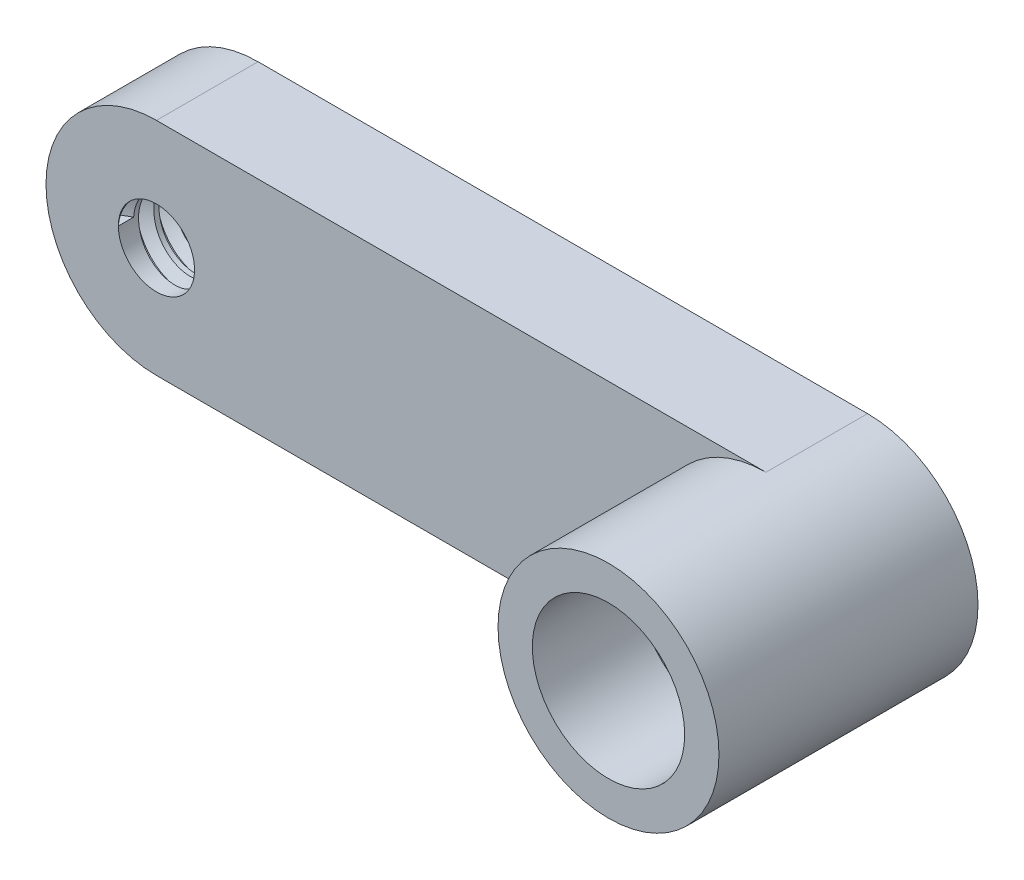
from build123d import *
from build123d.topology import SkipClean

# Parameters (mm, degrees)
SKETCH_1_R           = 1.72343644
SKETCH_1_R_2         = 1.5
EXTRUDE_1_DEPTH      = 2.1
EXTRUDE_START        = -2.1
SKETCH_12_R          = 2.175
SKETCH_12_R_2        = 1.72343644
EXTRUDE_4_DEPTH      = 2.1
EXTRUDE_START_2      = 3
EXTRUDE_6_DEPTH      = 3
SKETCH_16_R          = 1
CUT_EXTRUDE_10_DEPTH = 15.651322466
CUT_EXTRUDE_START    = -1
CUT_EXTRUDE_11_DEPTH = 1
SKETCH_18_R          = 0.75
CUT_EXTRUDE_12_DEPTH = 16.220750639
THREAD_1_PITCH       = 0.4


with BuildPart() as part:
    # Sketch 1 → 凸台-拉伸1 (new body)
    with BuildSketch(Plane.XY):
        Circle(SKETCH_1_R)
        Circle(SKETCH_1_R_2, mode=Mode.SUBTRACT)
    extrude(amount=EXTRUDE_1_DEPTH)

    # 草图12 → 凸台-拉伸4 (add)
    with BuildSketch(Plane.XY.offset(2.1).offset(EXTRUDE_START)):
        Circle(SKETCH_12_R)
        Circle(SKETCH_12_R_2, mode=Mode.SUBTRACT)
    extrude(amount=EXTRUDE_4_DEPTH)

    # 草图15 → 凸台-拉伸6 (add)
    with BuildSketch(Plane(origin=(0, 0, 0), x_dir=(-1, 0, 0), z_dir=(0, 0, -1)).offset(EXTRUDE_START_2)):
        with BuildLine():
            Line((0, 2.175), (12, 2.175))
            ThreePointArc((12, 2.175), (14.175, 0), (12, -2.175))
            Line((12, -2.175), (0, -2.175))
            ThreePointArc((0, -2.175), (-2.175, 0), (0, 2.175))
        make_face()
    extrude(amount=-EXTRUDE_6_DEPTH)

    # 草图16 → 切除-拉伸10 (cut, through all)
    with BuildSketch(Plane.XY):
        Circle(SKETCH_16_R)
    extrude(amount=-CUT_EXTRUDE_10_DEPTH, mode=Mode.SUBTRACT)

    # 草图17 → 切除-拉伸11 (cut)
    with SkipClean():  # the faces are left unmerged after this step: merging them gives an invalid solid
        with BuildSketch(Plane.XY.offset(CUT_EXTRUDE_START)):
            with BuildLine():
                Line((0, 2.175), (-12, 2.175))
                ThreePointArc((-12, 2.175), (-14.175, 0), (-12, -2.175))
                Line((-12, -2.175), (0, -2.175))
                ThreePointArc((0, -2.175), (-2.175, 0), (0, 2.175))
            make_face()
        extrude(amount=CUT_EXTRUDE_11_DEPTH, mode=Mode.SUBTRACT)

    # 草图18 → 切除-拉伸12 (cut, through all)
    with SkipClean():  # the faces are left unmerged after this step: merging them gives an invalid solid
        with BuildSketch(Plane(origin=(0, 0, -3), x_dir=(-1, 0, 0), z_dir=(0, 0, -1))):
            with Locations((12, 0)):
                Circle(SKETCH_18_R)
        extrude(amount=-CUT_EXTRUDE_12_DEPTH, mode=Mode.SUBTRACT)

    # 螺纹线1: the profile of Sketch 1 2 profile screwed along a right-hand helix of 25 turns, 6 arcs to a turn; built about Z, then put on its axis
    with SkipClean():  # the faces are left unmerged after this step: merging them gives an invalid solid
        thread_1_z = Axis((0, 0, 0), (0, 0, 1))
        thread_1_corners = [(0.7497, 0, -0.000173205), (0.96650635, 0, 0.124999999), (0.96650635, 0, 0.174999999), (0.7497, 0, 0.300173204)]
        with BuildLine(mode=Mode.PRIVATE) as thread_1_profile:
            Line(thread_1_corners[0], thread_1_corners[1])
            Line(thread_1_corners[1], thread_1_corners[2])
            Line(thread_1_corners[2], thread_1_corners[3])
            Line(thread_1_corners[3], thread_1_corners[0])
        thread_1_cap = Face(thread_1_profile.wire())
        thread_1_turn_angles = [0, 30, 60, 90, 120, 150, 180, 210, 240, 270, 300, 330, 360]
        thread_1_turn_weights = [1, 0.8660254037844387, 1, 0.8660254037844387, 1, 0.8660254037844387, 1, 0.8660254037844387, 1, 0.8660254037844387, 1, 0.8660254037844387, 1]
        thread_1_turn_rails = [Edge.make_bspline([Vector(p[0], p[1], 0).rotate(thread_1_z, thread_1_turn_angles[k]) / thread_1_turn_weights[k] + Vector(0, 0, p[2] + THREAD_1_PITCH * thread_1_turn_angles[k] / 360) for k in range(13)], [0, 0, 0, 1, 1, 2, 2, 3, 3, 4, 4, 5, 5, 6, 6, 6], 2, thread_1_turn_weights) for p in thread_1_corners]
        thread_1_turn_sides = [Face.make_surface_from_curves(thread_1_turn_rails[p[0]], thread_1_turn_rails[p[1]]) for p in [(0, 1), (1, 2), (2, 3), (3, 0)]]
        thread_1 = Plane(origin=(-12, 0, -1), x_dir=(-1, 0, 0), z_dir=(0, 0, -1)) * Solid(Shell([*[p.moved(Location((0, 0, THREAD_1_PITCH * i))) for i in range(25) for p in thread_1_turn_sides], thread_1_cap, thread_1_cap.rotate(thread_1_z, 9000).moved(Location((0, 0, THREAD_1_PITCH * 9000 / 360)))]))
        add(thread_1, mode=Mode.SUBTRACT)


solid = part.part
